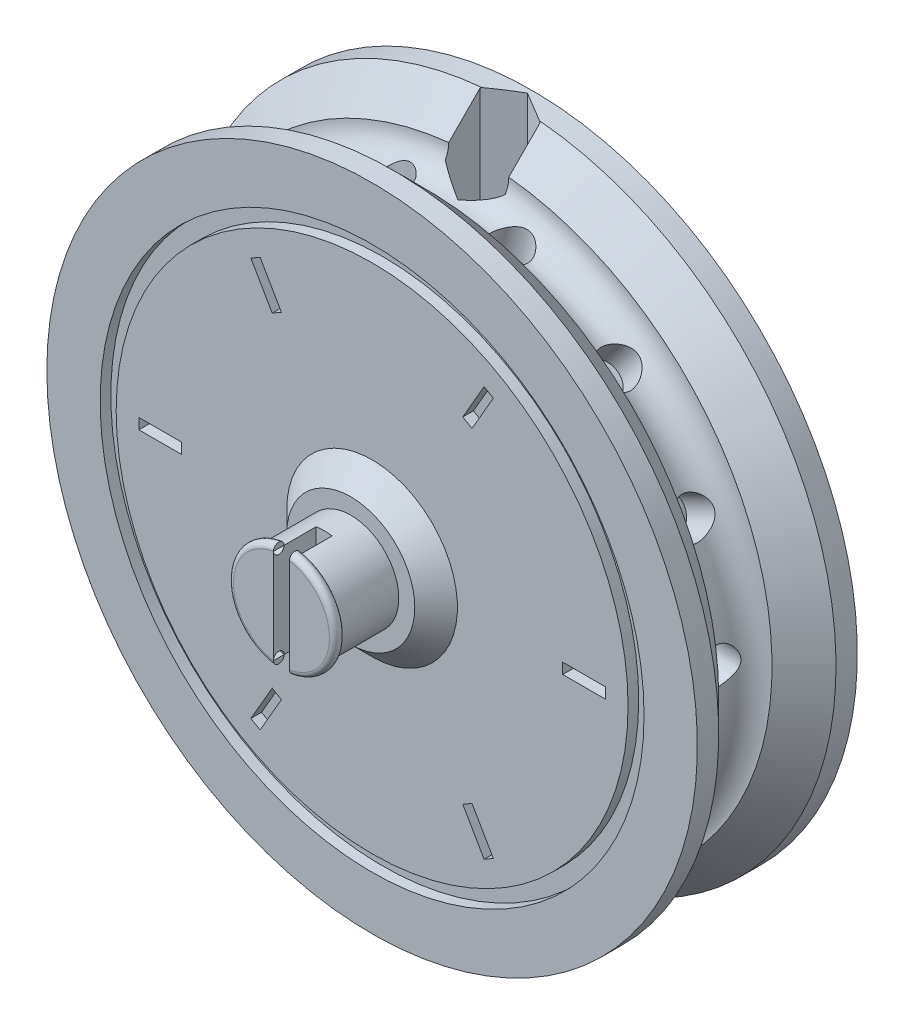
from build123d import *

# Parameters (mm, degrees)
SALIENTE_EXTRUIR1_DEPTH    = 7.7
CORTAR_EXTRUIR1_DEPTH      = 19.533842919
CORTAR_EXTRUIR1_DEPTH_BACK = 19.533842919
CROQUIS3_R                 = 1.65
CROQUIS5_R                 = 2.6
CORTAR_EXTRUIR2_DEPTH      = 48.357153631
CORTAR_EXTRUIR3_DEPTH      = 44.815408405
CROQUIS7_R                 = 6
SALIENTE_EXTRUIR2_DEPTH    = 2
CROQUIS8_R                 = 4.5
SALIENTE_EXTRUIR3_DEPTH    = 5.5
CHAFL_N1_SIZE              = 2
CROQUIS10_W                = 1.5
CROQUIS10_H                = 10
CORTAR_EXTRUIR6_DEPTH      = 4
CORTAR_EXTRUIR7_DEPTH      = 8
CROQUIS15_R                = 25.5
CROQUIS15_R_2              = 24
CORTAR_EXTRUIR8_DEPTH      = 1
CROQUIS16_R                = 1.75
CORTAR_EXTRUIR10_DEPTH     = 8
MATRIZC1_COUNT             = 14
CROQUIS17_W                = 4
CROQUIS17_H                = 1
CORTAR_EXTRUIR11_DEPTH     = 1
MATRIZC2_COUNT             = 6


with BuildPart() as part:
    # Croquis2 → Saliente-Extruir1 (new body)
    with BuildSketch(Plane.XY.offset(-7.7)):
        Polygon((-8.42931393, 0), (-4.214656965, -7.3), (4.214656965, -7.3), (8.42931393, 0), (4.214656965, 7.3), (-4.214656965, 7.3), align=None)
        Polygon((-3.059956427, -5.3), (3.059956427, -5.3), (6.119912853, 0), (3.059956427, 5.3), (-3.059956427, 5.3), (-6.119912853, 0), align=None, mode=Mode.SUBTRACT)
    extrude(amount=SALIENTE_EXTRUIR1_DEPTH)

    # Croquis3 → Cortar-Extruir1 (cut, two sides: drawn at the far end of the back side and taken through both)
    with BuildSketch(Plane.XZ.offset(7.3).offset(-CORTAR_EXTRUIR1_DEPTH_BACK)):
        with Locations(Location((0, -4, 0), (0, 0, 90))):
            Circle(CROQUIS3_R)
    extrude(amount=CORTAR_EXTRUIR1_DEPTH + CORTAR_EXTRUIR1_DEPTH_BACK, mode=Mode.SUBTRACT)

    # Croquis4 → Revolución1 (revolve)
    with BuildSketch(Plane(origin=(0, 0, 0), x_dir=(1, 0, 0), z_dir=(0, 1, 0)), mode=Mode.PRIVATE) as revoluci_n1_sk:
        with BuildLine():
            Line((0, 7.7), (0, -7.3))
            Line((0, -7.3), (30.5, -7.3))
            Line((30.5, -7.3), (30.5, -5.3))
            Line((30.5, -5.3), (27.5, -2.3))
            ThreePointArc((27.5, -2.3), (25, 0.2), (27.5, 2.7))
            Line((27.5, 2.7), (30.5, 5.7))
            Line((30.5, 5.7), (30.5, 7.7))
            Line((30.5, 7.7), (0, 7.7))
        make_face()
    revolve(revoluci_n1_sk.sketch.rotate(Axis((0, 0, -7.7), (0, 0, 1)), 180), axis=Axis((0, 0, -7.7), (0, 0, 1)))

    # Croquis5 → Cortar-Extruir2 (cut, through all)
    with BuildSketch(Plane(origin=(0, 4.9, 0), x_dir=(1, 0, 0), z_dir=(0, 1, 0))):
        with Locations(Location((0, 4, 0), (0, 0, 270))):
            Circle(CROQUIS5_R)
    extrude(amount=-CORTAR_EXTRUIR2_DEPTH, mode=Mode.SUBTRACT)

    # Croquis6 → Cortar-Extruir3 (cut, through all)
    with BuildSketch(Plane(origin=(0, 0, 0), x_dir=(1, 0, 0), z_dir=(0, 1, 0))):
        Polygon((0, 0.75), (2.814582562, 2.375), (2.814582562, 5.625), (0, 7.25), (-2.814582562, 5.625), (-2.814582562, 2.375), align=None)
    extrude(amount=CORTAR_EXTRUIR3_DEPTH, mode=Mode.SUBTRACT)

    # Croquis7 → Saliente-Extruir2 (add)
    with BuildSketch(Plane.XY.offset(7.3)):
        Circle(CROQUIS7_R)
    extrude(amount=SALIENTE_EXTRUIR2_DEPTH)

    # Croquis8 → Saliente-Extruir3 (add)
    with BuildSketch(Plane.XY.offset(9.3)):
        Circle(CROQUIS8_R)
    extrude(amount=SALIENTE_EXTRUIR3_DEPTH)

    # Chaflán1
    chafl_n1_edges = [part.edges().sort_by_distance(p)[0] for p in [
        (-6, 0, 7.3),
    ]]
    chamfer(chafl_n1_edges, length=CHAFL_N1_SIZE - 0.0001)  # a hair under: the kernel refuses the full size

    # Croquis9 → Revolución2 (revolve)
    with BuildSketch(Plane(origin=(0, 0, 0), x_dir=(1, 0, 0), z_dir=(0, 1, 0))):
        with BuildLine():
            Line((0, -14.8), (-4.5, -14.8))
            ThreePointArc((-4.5, -14.8), (-4.146446609, -14.946446609), (-4, -15.3))
            ThreePointArc((-4, -15.3), (-4.146446609, -15.653553391), (-4.5, -15.8))
            Line((-4.5, -15.8), (0, -15.8))
            Line((0, -15.8), (0, -14.8))
        make_face()
        with BuildLine():
            Line((-4.5, -15.3), (-4.5, -14.8))
            ThreePointArc((-4.5, -14.8), (-5, -15.3), (-4.5, -15.8))
            Line((-4.5, -15.8), (-4.5, -15.3))
        make_face()
    revolve(axis=Axis((0, 0, 14.8), (0, 0, 1)))

    # Croquis10 → Cortar-Extruir6 (cut)
    with BuildSketch(Plane.XY.offset(15.8)):
        Rectangle(CROQUIS10_W, CROQUIS10_H)
    extrude(amount=-CORTAR_EXTRUIR6_DEPTH, mode=Mode.SUBTRACT)

    # Croquis12 → Cortar-Extruir7 (cut)
    with BuildSketch(Plane(origin=(0, 0, -7.7), x_dir=(-1, 0, 0), z_dir=(0, 0, -1))):
        Polygon((6.119912853, 0), (3.059956427, 5.3), (-3.059956427, 5.3), (-6.119912853, 0), (-3.059956427, -5.3), (3.059956427, -5.3), align=None)
    extrude(amount=-CORTAR_EXTRUIR7_DEPTH, mode=Mode.SUBTRACT)

    # Croquis15 → Cortar-Extruir8 (cut)
    with BuildSketch(Plane.XY.offset(7.3)):
        Circle(CROQUIS15_R)
        Circle(CROQUIS15_R_2, mode=Mode.SUBTRACT)
    extrude(amount=-CORTAR_EXTRUIR8_DEPTH, mode=Mode.SUBTRACT)

    # Croquis16 → Cortar-Extruir10 (cut)
    with BuildSketch(Plane(origin=(30.5, 0, 0), x_dir=(0, 0, -1), z_dir=(1, 0, 0))):
        with Locations(Location((0, 0, 0), (0, 0, 90))):
            Circle(CROQUIS16_R)
    cortar_extruir10 = extrude(amount=-CORTAR_EXTRUIR10_DEPTH, mode=Mode.SUBTRACT)

    # MatrizC1: Cortar-Extruir10 ×14 about axis
    matrizc1_axis = Axis((0, 0, 0), (0, 0, 1))
    for i in range(1, MATRIZC1_COUNT):
        add(cortar_extruir10.rotate(matrizc1_axis, i * 360 / MATRIZC1_COUNT), mode=Mode.SUBTRACT)

    # Croquis17 → Cortar-Extruir11 (cut)
    with BuildSketch(Plane.XY.offset(7.3)):
        with Locations((19.870465208, 0)):
            Rectangle(CROQUIS17_W, CROQUIS17_H)
    cortar_extruir11 = extrude(amount=-CORTAR_EXTRUIR11_DEPTH, mode=Mode.SUBTRACT)

    # MatrizC2: Cortar-Extruir11 ×6 about axis
    matrizc2_axis = Axis((0, 0, 0), (0, 0, 1))
    for i in range(1, MATRIZC2_COUNT):
        add(cortar_extruir11.rotate(matrizc2_axis, i * 360 / MATRIZC2_COUNT), mode=Mode.SUBTRACT)


solid = part.part
